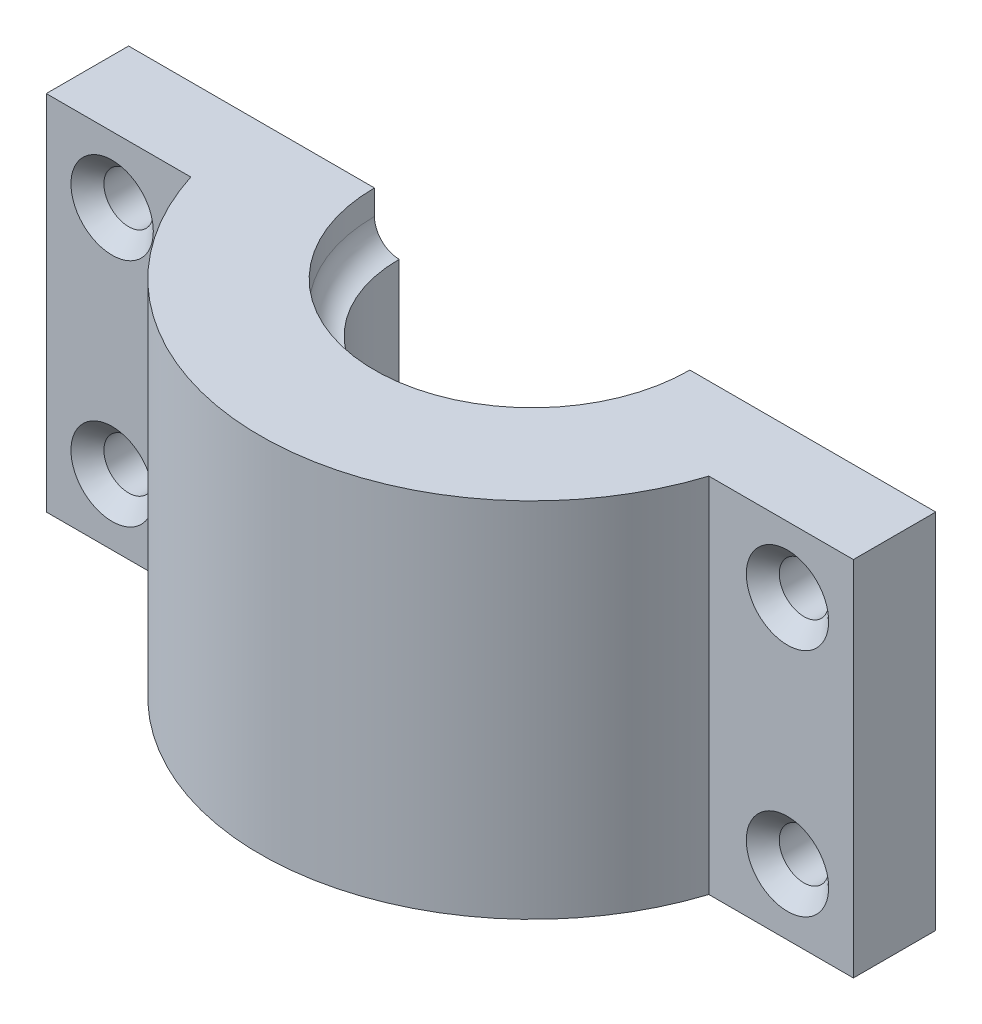
from build123d import *

# Parameters (mm, degrees)
BOSS_EXTRUDE1_DEPTH     = 22
BOSS_EXTRUDE3_START     = -5
BOSS_EXTRUDE3_OUTLINE_R = 1.5
BOSS_EXTRUDE3_DEPTH     = 5
CHAMFER2_SIZE           = 1
CHAMFER3_SIZE           = 7
CHAMFER3_SIZE2          = 2


# Read off the part's stored shape, not the designer's step: Boss-Extrude3
with BuildPart() as part:
    # Sketch1 → Boss-Extrude1 (new body)
    with BuildSketch(Plane(origin=(0, 0, 0), x_dir=(1, 0, 0), z_dir=(0, 1, 0))):
        with BuildLine():
            Line((0, -16.5), (0, -8.075))
            ThreePointArc((3.5438e-13, -8.075), (-5.709887258081245, -5.709887258081495), (-8.075, 1.03e-15))
            Line((-8.075, 0), (-16.5, 0))
            Line((-16.5, 0), (-24.5, -9.8e-16))
            Line((-24.5, -9.8e-16), (-24.5, -5.000000000000001))
            Line((-24.5, -5.000000000000001), (-15.724185193516389, -5.000000000000001))
            ThreePointArc((-15.724185193516387, -5), (-9.740379869388931, -13.318220601867306), (3.5527e-13, -16.5))
        make_face()
        with BuildLine():
            Line((24.5, -9.8e-16), (16.5, 0))
            Line((16.5, 0), (8.075, 0))
            ThreePointArc((8.075, 3.34e-15), (5.709887258081497, -5.709887258081244), (3.5438e-13, -8.075))
            Line((0, -8.075), (0, -16.5))
            ThreePointArc((3.5527e-13, -16.5), (9.74037986938922, -13.3182206018671), (15.724185193516387, -5.000000000000004))
            Line((15.724185193516389, -5.000000000000001), (24.5, -5.000000000000001))
            Line((24.5, -5.000000000000001), (24.5, -9.8e-16))
        make_face()
    extrude(amount=-BOSS_EXTRUDE1_DEPTH)

    # Boss-Extrude3 outline → Boss-Extrude3 (cut)
    with BuildSketch(Plane.XY.offset(5.000000000000001).offset(BOSS_EXTRUDE3_START)):
        with Locations((20.5, -18)):
            Circle(BOSS_EXTRUDE3_OUTLINE_R)
        with Locations((20.5, -4)):
            Circle(BOSS_EXTRUDE3_OUTLINE_R)
        with Locations((-20.5, -4)):
            Circle(BOSS_EXTRUDE3_OUTLINE_R)
        with Locations((-20.5, -18)):
            Circle(BOSS_EXTRUDE3_OUTLINE_R)
    extrude(amount=BOSS_EXTRUDE3_DEPTH, mode=Mode.SUBTRACT)

    # Chamfer2
    chamfer2_edges = [part.edges().sort_by_distance(p)[0] for p in [
        (-22, -18, 5.000000000000001),
        (19, -4, 5.000000000000001),
        (19, -18, 5.000000000000001),
        (-22, -4, 5.000000000000001),
    ]]
    chamfer(chamfer2_edges, length=CHAMFER2_SIZE)

    # Chamfer3
    chamfer3_edges = [part.edges().sort_by_distance(p)[0] for p in [
        (1.54e-15, -22, 8.075),
    ]]
    chamfer3_side = [part.faces().sort_by_distance(p)[0] for p in [
        (2.05e-15, -11, 8.075),
    ]]
    chamfer(chamfer3_edges, length=CHAMFER3_SIZE, length2=CHAMFER3_SIZE2, reference=chamfer3_side[0])

    # Sketch4 → Cut-Revolve1 (revolve, cut)
    with BuildSketch(Plane(origin=(0, 0, 0), x_dir=(-1, 0, -1.2e-16), z_dir=(1.2e-16, 0, -1))):
        with BuildLine():
            Line((-9.575, 0.4703111185771576), (-9.575, -1.4999999999999998))
            ThreePointArc((-9.575, -1.4999999999999998), (-7.014339828220178, -2.560660171779821), (-8.075, 0))
            Line((-8.075, 0), (-9.575, 0.4703111185771576))
        make_face()
    revolve(axis=Axis((4.3e-16, 1.8602118411515838, 0), (-1.7e-16, -1, 0)), mode=Mode.SUBTRACT)


solid = part.part
